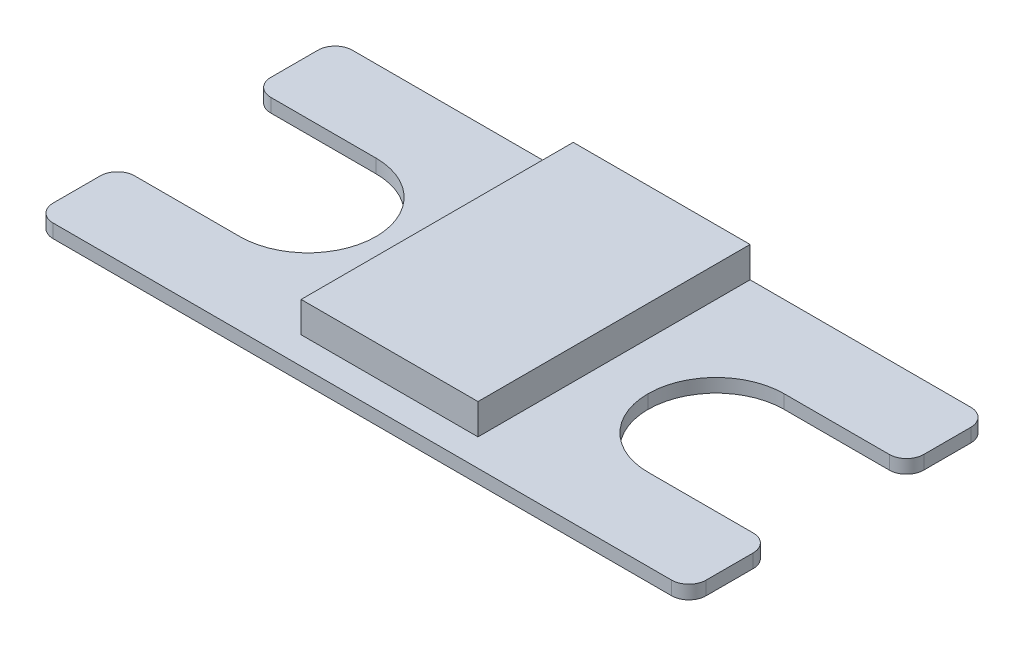
from build123d import *

# Parameters (mm, degrees)
BOSS_EXTRUDE1_DEPTH = 1
FILLET1_R           = 1.27
FILLET2_R           = 5
SKETCH2_W           = 13
SKETCH2_H           = 20
BOSS_EXTRUDE2_DEPTH = 2.25


with BuildPart() as part:
    # Sketch1 → Boss-Extrude1 (new body)
    with BuildSketch(Plane(origin=(0, 0, 0), x_dir=(1, 0, 0), z_dir=(0, 1, 0))):
        Polygon((0, 0), (0, 6), (14, 6), (14, 16), (0, 16), (0, 22), (48, 22), (48, 16), (34, 16), (34, 6), (48, 6), (48, 0), align=None)
    extrude(amount=BOSS_EXTRUDE1_DEPTH)

    # Fillet1
    fillet1_edges = [part.edges().sort_by_distance(p)[0] for p in [
        (0, 0.5, 0),
        (0, 0.5, -6),
        (0, 0.5, -16),
        (0, 0.5, -22),
        (48, 0.5, -22),
        (48, 0.5, -16),
        (48, 0.5, -6),
        (48, 0.5, 0),
    ]]
    fillet(fillet1_edges, radius=FILLET1_R)

    # Fillet2
    fillet2_edges = [part.edges().sort_by_distance(p)[0] for p in [
        (34, 0.5, -6),
        (34, 0.5, -16),
        (14, 0.5, -6),
        (14, 0.5, -16),
    ]]
    fillet(fillet2_edges, radius=FILLET2_R - 0.0001)  # a hair under: the kernel refuses the full size

    # Sketch2 → Boss-Extrude2 (add)
    with BuildSketch(Plane(origin=(0, 1, 0), x_dir=(1, 0, 0), z_dir=(0, 1, 0))):
        with Locations((24, 12)):
            Rectangle(SKETCH2_W, SKETCH2_H)
    extrude(amount=BOSS_EXTRUDE2_DEPTH)


solid = part.part
